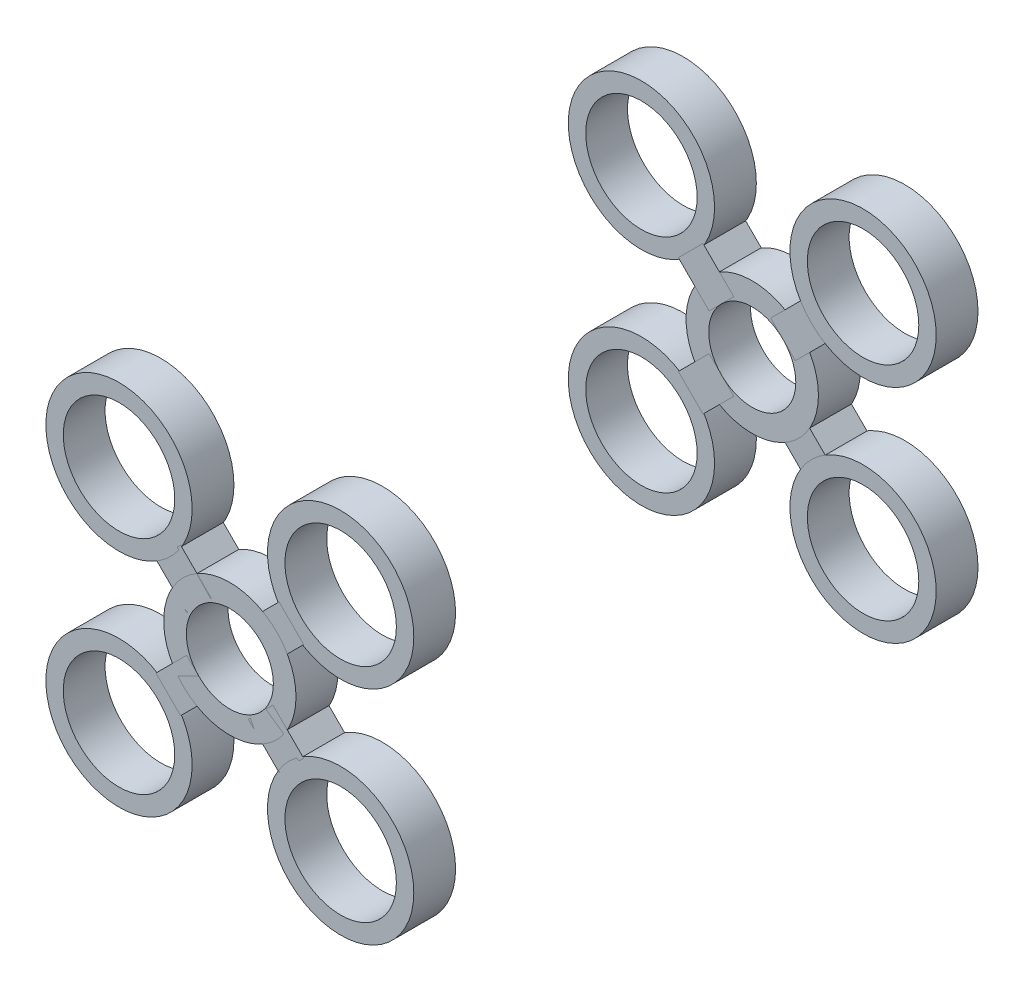
from build123d import *

# Parameters (mm, degrees)
EXTRUDE_START         = -62
EXTRUDE_SKETCH_1_R    = 21
EXTRUDE_SKETCH_1_R_2  = 16
EXTRUDE_1_DEPTH       = 12
EXTRUDE_2_DEPTH       = 12
EXTRUDE_SKETCH_3_R    = 21
EXTRUDE_SKETCH_3_R_2  = 16
EXTRUDE_3_DEPTH       = 12
EXTRUDE_4_DEPTH       = 12
EXTRUDE_SKETCH_5_R    = 21
EXTRUDE_SKETCH_5_R_2  = 16
EXTRUDE_5_DEPTH       = 12
EXTRUDE_6_DEPTH       = 12
EXTRUDE_SKETCH_7_R    = 21
EXTRUDE_SKETCH_7_R_2  = 16
EXTRUDE_7_DEPTH       = 12
EXTRUDE_8_DEPTH       = 12
EXTRUDE_SKETCH_9_R    = 19
EXTRUDE_SKETCH_9_R_2  = 12.5
EXTRUDE_9_DEPTH       = 12
EXTRUDE_START_2       = -212
EXTRUDE_SKETCH_10_R   = 21
EXTRUDE_SKETCH_10_R_2 = 16
EXTRUDE_10_DEPTH      = 12
EXTRUDE_11_DEPTH      = 12
EXTRUDE_SKETCH_12_R   = 21
EXTRUDE_SKETCH_12_R_2 = 16
EXTRUDE_12_DEPTH      = 12
EXTRUDE_13_DEPTH      = 12
EXTRUDE_SKETCH_14_R   = 21
EXTRUDE_SKETCH_14_R_2 = 16
EXTRUDE_14_DEPTH      = 12
EXTRUDE_15_DEPTH      = 12
EXTRUDE_SKETCH_16_R   = 21
EXTRUDE_SKETCH_16_R_2 = 16
EXTRUDE_16_DEPTH      = 12
EXTRUDE_17_DEPTH      = 12
EXTRUDE_SKETCH_18_R   = 19
EXTRUDE_SKETCH_18_R_2 = 12.5
EXTRUDE_18_DEPTH      = 12


with BuildPart() as part:
    # Extrude sketch 1 → Extrude 1 (new body)
    with BuildSketch(Plane.XY.offset(EXTRUDE_START)):
        with Locations((271.819805153, 31.819805153)):
            Circle(EXTRUDE_SKETCH_1_R)
        with Locations((271.819805153, 31.819805153)):
            Circle(EXTRUDE_SKETCH_1_R_2, mode=Mode.SUBTRACT)
    extrude(amount=EXTRUDE_1_DEPTH)


with BuildPart() as body_2:
    # Extrude sketch 2 → Extrude 2 (new body)
    with BuildSketch(Plane.XY.offset(EXTRUDE_START)):
        Polygon((252.374368671, 5.303300859), (261.213203436, 14.142135624), (254.142135624, 21.213203436), (245.303300859, 12.374368671), align=None)
    extrude(amount=EXTRUDE_2_DEPTH)


with BuildPart() as body_3:
    # Extrude sketch 3 → Extrude 3 (new body)
    with BuildSketch(Plane.XY.offset(EXTRUDE_START)):
        with Locations((208.180194847, 31.819805153)):
            Circle(EXTRUDE_SKETCH_3_R)
        with Locations((208.180194847, 31.819805153)):
            Circle(EXTRUDE_SKETCH_3_R_2, mode=Mode.SUBTRACT)
    extrude(amount=EXTRUDE_3_DEPTH)


with BuildPart() as body_4:
    # Extrude sketch 4 → Extrude 4 (new body)
    with BuildSketch(Plane.XY.offset(EXTRUDE_START)):
        Polygon((234.696699141, 12.374368671), (225.857864376, 21.213203436), (218.786796564, 14.142135624), (227.625631329, 5.303300859), align=None)
    extrude(amount=EXTRUDE_4_DEPTH)


with BuildPart() as body_5:
    # Extrude sketch 5 → Extrude 5 (new body)
    with BuildSketch(Plane.XY.offset(EXTRUDE_START)):
        with Locations((208.180194847, -31.819805153)):
            Circle(EXTRUDE_SKETCH_5_R)
        with Locations((208.180194847, -31.819805153)):
            Circle(EXTRUDE_SKETCH_5_R_2, mode=Mode.SUBTRACT)
    extrude(amount=EXTRUDE_5_DEPTH)


with BuildPart() as body_6:
    # Extrude sketch 6 → Extrude 6 (new body)
    with BuildSketch(Plane.XY.offset(EXTRUDE_START)):
        Polygon((227.625631329, -5.303300859), (218.786796564, -14.142135624), (225.857864376, -21.213203436), (234.696699141, -12.374368671), align=None)
    extrude(amount=EXTRUDE_6_DEPTH)


with BuildPart() as body_7:
    # Extrude sketch 7 → Extrude 7 (new body)
    with BuildSketch(Plane.XY.offset(EXTRUDE_START)):
        with Locations((271.819805153, -31.819805153)):
            Circle(EXTRUDE_SKETCH_7_R)
        with Locations((271.819805153, -31.819805153)):
            Circle(EXTRUDE_SKETCH_7_R_2, mode=Mode.SUBTRACT)
    extrude(amount=EXTRUDE_7_DEPTH)


with BuildPart() as body_8:
    # Extrude sketch 8 → Extrude 8 (new body)
    with BuildSketch(Plane.XY.offset(EXTRUDE_START)):
        Polygon((245.303300859, -12.374368671), (254.142135624, -21.213203436), (261.213203436, -14.142135624), (252.374368671, -5.303300859), align=None)
    extrude(amount=EXTRUDE_8_DEPTH)


with BuildPart() as body_9:
    # Extrude sketch 9 → Extrude 9 (new body)
    with BuildSketch(Plane.XY.offset(EXTRUDE_START)):
        with Locations((240, 0)):
            Circle(EXTRUDE_SKETCH_9_R)
        with Locations((240, 0)):
            Circle(EXTRUDE_SKETCH_9_R_2, mode=Mode.SUBTRACT)
    extrude(amount=EXTRUDE_9_DEPTH)


with BuildPart() as body_10:
    # Extrude sketch 10 → Extrude 10 (new body)
    with BuildSketch(Plane.XY.offset(EXTRUDE_START_2)):
        with Locations((271.819805153, 31.819805153)):
            Circle(EXTRUDE_SKETCH_10_R)
        with Locations((271.819805153, 31.819805153)):
            Circle(EXTRUDE_SKETCH_10_R_2, mode=Mode.SUBTRACT)
    extrude(amount=EXTRUDE_10_DEPTH)


with BuildPart() as body_11:
    # Extrude sketch 11 → Extrude 11 (new body)
    with BuildSketch(Plane.XY.offset(EXTRUDE_START_2)):
        Polygon((252.374368671, 5.303300859), (261.213203436, 14.142135624), (254.142135624, 21.213203436), (245.303300859, 12.374368671), align=None)
    extrude(amount=EXTRUDE_11_DEPTH)


with BuildPart() as body_12:
    # Extrude sketch 12 → Extrude 12 (new body)
    with BuildSketch(Plane.XY.offset(EXTRUDE_START_2)):
        with Locations((208.180194847, 31.819805153)):
            Circle(EXTRUDE_SKETCH_12_R)
        with Locations((208.180194847, 31.819805153)):
            Circle(EXTRUDE_SKETCH_12_R_2, mode=Mode.SUBTRACT)
    extrude(amount=EXTRUDE_12_DEPTH)


with BuildPart() as body_13:
    # Extrude sketch 13 → Extrude 13 (new body)
    with BuildSketch(Plane.XY.offset(EXTRUDE_START_2)):
        Polygon((234.696699141, 12.374368671), (225.857864376, 21.213203436), (218.786796564, 14.142135624), (227.625631329, 5.303300859), align=None)
    extrude(amount=EXTRUDE_13_DEPTH)


with BuildPart() as body_14:
    # Extrude sketch 14 → Extrude 14 (new body)
    with BuildSketch(Plane.XY.offset(EXTRUDE_START_2)):
        with Locations((208.180194847, -31.819805153)):
            Circle(EXTRUDE_SKETCH_14_R)
        with Locations((208.180194847, -31.819805153)):
            Circle(EXTRUDE_SKETCH_14_R_2, mode=Mode.SUBTRACT)
    extrude(amount=EXTRUDE_14_DEPTH)


with BuildPart() as body_15:
    # Extrude sketch 15 → Extrude 15 (new body)
    with BuildSketch(Plane.XY.offset(EXTRUDE_START_2)):
        Polygon((227.625631329, -5.303300859), (218.786796564, -14.142135624), (225.857864376, -21.213203436), (234.696699141, -12.374368671), align=None)
    extrude(amount=EXTRUDE_15_DEPTH)


with BuildPart() as body_16:
    # Extrude sketch 16 → Extrude 16 (new body)
    with BuildSketch(Plane.XY.offset(EXTRUDE_START_2)):
        with Locations((271.819805153, -31.819805153)):
            Circle(EXTRUDE_SKETCH_16_R)
        with Locations((271.819805153, -31.819805153)):
            Circle(EXTRUDE_SKETCH_16_R_2, mode=Mode.SUBTRACT)
    extrude(amount=EXTRUDE_16_DEPTH)


with BuildPart() as body_17:
    # Extrude sketch 17 → Extrude 17 (new body)
    with BuildSketch(Plane.XY.offset(EXTRUDE_START_2)):
        Polygon((245.303300859, -12.374368671), (254.142135624, -21.213203436), (261.213203436, -14.142135624), (252.374368671, -5.303300859), align=None)
    extrude(amount=EXTRUDE_17_DEPTH)


with BuildPart() as body_18:
    # Extrude sketch 18 → Extrude 18 (new body)
    with BuildSketch(Plane.XY.offset(EXTRUDE_START_2)):
        with Locations((240, 0)):
            Circle(EXTRUDE_SKETCH_18_R)
        with Locations((240, 0)):
            Circle(EXTRUDE_SKETCH_18_R_2, mode=Mode.SUBTRACT)
    extrude(amount=EXTRUDE_18_DEPTH)


solid = Compound([part.part, body_2.part, body_3.part, body_4.part, body_5.part, body_6.part, body_7.part, body_8.part, body_9.part, body_10.part, body_11.part, body_12.part, body_13.part, body_14.part, body_15.part, body_16.part, body_17.part, body_18.part])
